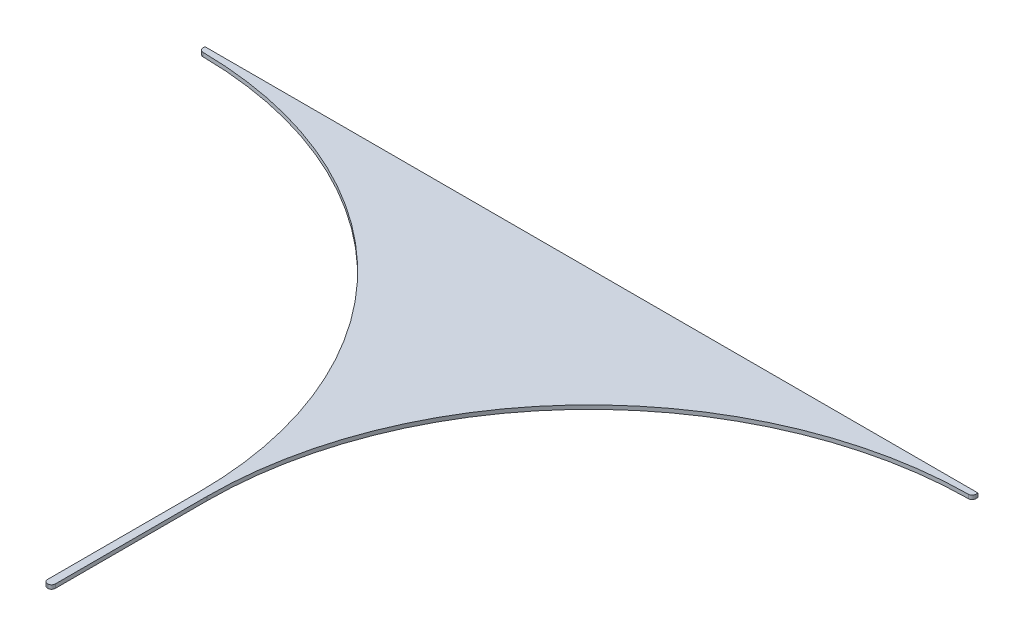
from build123d import *

# Parameters (mm, degrees)
BASE_FLANGE1_DEPTH = 2


# Sheet-metal steps are written as plain solids
with BuildPart() as part:
    # Sketch1 → Base-Flange1 (new body)
    with BuildSketch(Plane(origin=(0, 0, 0), x_dir=(1, 0, 0), z_dir=(0, 1, 0))):
        with BuildLine():
            Line((0, 0), (398, 0))
            Line((398, 0), (398, -1.109075119))
            ThreePointArc((398, -1.109075119), (397.449904564, -2.446145673), (396.118149824, -3.008988429))
            ThreePointArc((396.118149824, -3.008988429), (258.03621096, -61.36689516), (201, -200))
            Line((201, -200), (201, -278.1))
            ThreePointArc((201, -278.1), (200.443502884, -279.443502884), (199.1, -280))
            Line((199.1, -280), (199, -280))
            Line((199, -280), (198.9, -280))
            ThreePointArc((198.9, -280), (197.556497116, -279.443502884), (197, -278.1))
            Line((197, -278.1), (197, -200))
            ThreePointArc((197, -200), (139.96378904, -61.36689516), (1.881850176, -3.008988429))
            ThreePointArc((1.881850176, -3.008988429), (0.550095436, -2.446145673), (0, -1.109075119))
            Line((0, -1.109075119), (0, 0))
        make_face()
    extrude(amount=-BASE_FLANGE1_DEPTH)


solid = part.part
